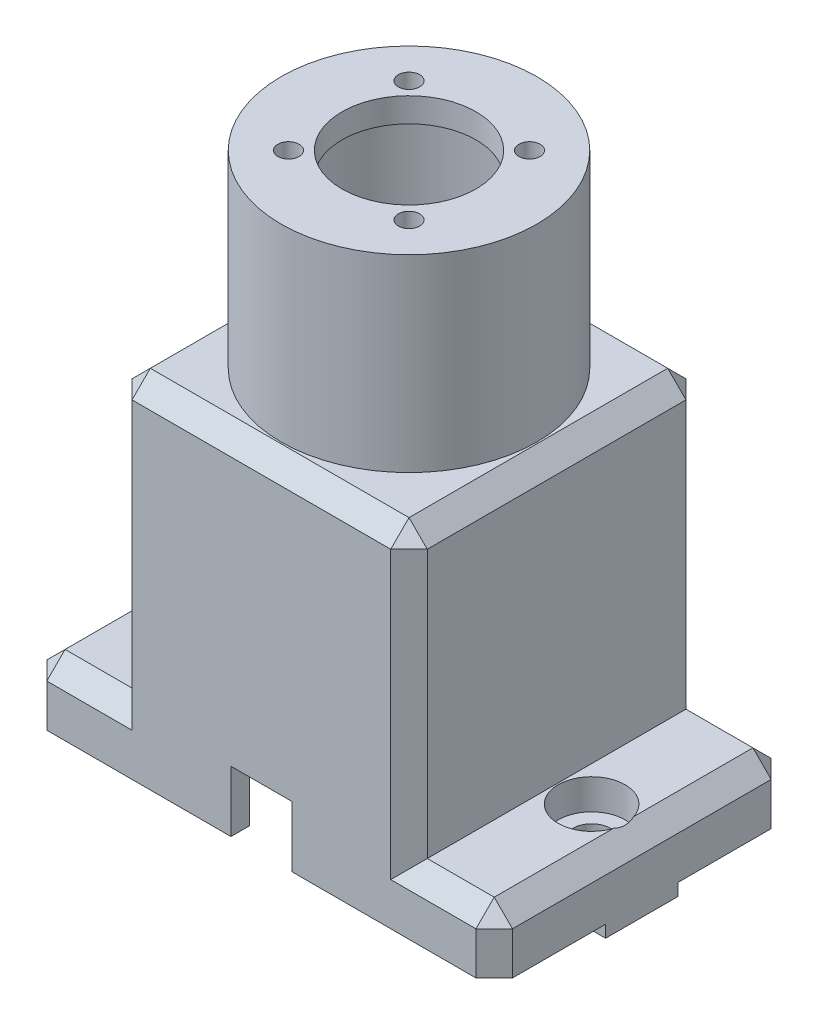
from build123d import *

# Parameters (mm, degrees)
SKETCH1_R               = 21
SKETCH1_R_2             = 1.75
BOSS_EXTRUDE1_DEPTH     = 31
SKETCH3_W               = 48.5
SKETCH3_H               = 48.5
SKETCH3_R               = 18.5
BOSS_EXTRUDE2_DEPTH     = 57
CUT_EXTRUDE2_DEPTH      = 67.521613029
CUT_EXTRUDE2_DEPTH_BACK = 67.521613029
SKETCH4_R               = 11
SKETCH5_W               = 10
SKETCH5_H               = 20
CUT_EXTRUDE3_DEPTH      = 67.521613029
BOSS_EXTRUDE3_START     = -57
SKETCH6_W               = 14
SKETCH6_H               = 48.5
BOSS_EXTRUDE3_DEPTH     = 10
BOSS_EXTRUDE4_START     = -57
SKETCH7_W               = 76.5
SKETCH7_H               = 11.9
BOSS_EXTRUDE4_DEPTH     = 2
CUT_EXTRUDE1_DEPTH      = 27
CUT_EXTRUDE1_DEPTH_BACK = 75.378256231
SKETCH2_R               = 18.5
SKETCH8_R               = 3.1
CUT_EXTRUDE4_DEPTH      = 75.378256231
CUT_EXTRUDE5_START      = -47
SKETCH9_R               = 5.5
CUT_EXTRUDE5_DEPTH      = 5
CUT_EXTRUDE6_DEPTH      = 53
CUT_EXTRUDE6_DEPTH_BACK = 75.378256231
CUT_EXTRUDE6_START      = -57
SKETCH11_W              = 42.5
SKETCH11_H              = 42.4


with BuildPart() as part:
    # Sketch1 → Boss-Extrude1 (new body)
    with BuildSketch(Plane(origin=(0, 0, 0), x_dir=(1, 0, 0), z_dir=(0, 1, 0))):
        with Locations(Location((0, 0, 0), (0, 0, 270))):
            Circle(SKETCH1_R)
        with Locations(Location((-9.899494937, -9.899494937, 0), (0, 0, 270))):
            Circle(SKETCH1_R_2, mode=Mode.SUBTRACT)
        with Locations(Location((-9.899494937, 9.899494937, 0), (0, 0, 270))):
            Circle(SKETCH1_R_2, mode=Mode.SUBTRACT)
        with Locations(Location((9.899494937, 9.899494937, 0), (0, 0, 270))):
            Circle(SKETCH1_R_2, mode=Mode.SUBTRACT)
        with Locations(Location((9.899494937, -9.899494937, 0), (0, 0, 270))):
            Circle(SKETCH1_R_2, mode=Mode.SUBTRACT)
    extrude(amount=BOSS_EXTRUDE1_DEPTH)

    # Sketch3 → Boss-Extrude2 (add)
    with BuildSketch(Plane(origin=(0, 0, 0), x_dir=(1, 0, 0), z_dir=(0, 1, 0))):
        Rectangle(SKETCH3_W, SKETCH3_H)
        with Locations(Location((0, 0, 0), (0, 0, 270))):
            Circle(SKETCH3_R, mode=Mode.SUBTRACT)
    extrude(amount=-BOSS_EXTRUDE2_DEPTH)

    # Sketch4 → Cut-Extrude2 (cut, two sides: drawn at the far end of the back side and taken through both)
    with BuildSketch(Plane(origin=(0, 0, 0), x_dir=(1, 0, 0), z_dir=(0, 1, 0)).offset(-CUT_EXTRUDE2_DEPTH_BACK)):
        with Locations(Location((0, 0, 0), (0, 0, 270))):
            Circle(SKETCH4_R)
    extrude(amount=CUT_EXTRUDE2_DEPTH + CUT_EXTRUDE2_DEPTH_BACK, mode=Mode.SUBTRACT)

    # Sketch5 → Cut-Extrude3 (cut, through all)
    with BuildSketch(Plane.XY):
        with Locations((0, -57)):
            Rectangle(SKETCH5_W, SKETCH5_H)
    extrude(amount=CUT_EXTRUDE3_DEPTH, mode=Mode.SUBTRACT)

    # Sketch6 → Boss-Extrude3 (add)
    with BuildSketch(Plane(origin=(0, 0, 0), x_dir=(1, 0, 0), z_dir=(0, 1, 0)).offset(BOSS_EXTRUDE3_START)):
        with Locations((-31.25, 0)):
            Rectangle(SKETCH6_W, SKETCH6_H)
        with Locations((31.25, 0)):
            Rectangle(SKETCH6_W, SKETCH6_H)
    extrude(amount=BOSS_EXTRUDE3_DEPTH)

    # Sketch7 → Boss-Extrude4 (add)
    with BuildSketch(Plane(origin=(0, 0, 0), x_dir=(1, 0, 0), z_dir=(0, 1, 0)).offset(BOSS_EXTRUDE4_START)):
        Rectangle(SKETCH7_W, SKETCH7_H)
    extrude(amount=-BOSS_EXTRUDE4_DEPTH)

    # Sketch2 → Cut-Extrude1 (cut, two sides: drawn at the far end of the back side and taken through both)
    with BuildSketch(Plane(origin=(0, 0, 0), x_dir=(1, 0, 0), z_dir=(0, 1, 0)).offset(-CUT_EXTRUDE1_DEPTH_BACK)):
        with Locations(Location((0, 0, 0), (0, 0, 270))):
            Circle(SKETCH2_R)
    extrude(amount=CUT_EXTRUDE1_DEPTH + CUT_EXTRUDE1_DEPTH_BACK, mode=Mode.SUBTRACT)

    # Sketch8 → Cut-Extrude4 (cut, through all)
    with BuildSketch(Plane(origin=(0, 0, 0), x_dir=(1, 0, 0), z_dir=(0, 1, 0))):
        with Locations(Location((-30, 0, 0), (0, 0, 270))):
            Circle(SKETCH8_R)
        with Locations(Location((30, 0, 0), (0, 0, 270))):
            Circle(SKETCH8_R)
    extrude(amount=-CUT_EXTRUDE4_DEPTH, mode=Mode.SUBTRACT)

    # Sketch9 → Cut-Extrude5 (cut)
    with BuildSketch(Plane(origin=(0, 0, 0), x_dir=(1, 0, 0), z_dir=(0, 1, 0)).offset(CUT_EXTRUDE5_START)):
        with Locations(Location((-30, 0, 0), (0, 0, 270))):
            Circle(SKETCH9_R)
        with Locations(Location((30, 0, 0), (0, 0, 270))):
            Circle(SKETCH9_R)
    extrude(amount=-CUT_EXTRUDE5_DEPTH, mode=Mode.SUBTRACT)

    # Chamfer1
    # the kernel refuses this chamfer: 3 mm, written as the material it takes off along each edge
    with BuildSketch(Plane(origin=(-22.25, -2, 22.25), x_dir=(0, -0.7071067811865476, 0.7071067811865476), z_dir=(-0.5773502691896257, 0.5773502691896257, 0.5773502691896257)), Plane(origin=(-22.25, -2, -22.25), x_dir=(-0.7071067811865476, -0.7071067811865476, 0), z_dir=(-0.5773502691896257, 0.5773502691896257, -0.5773502691896257)), Plane(origin=(36.25, -49, 22.25), x_dir=(-1.6747652892626914e-15, 0.7071067811865467, -0.7071067811865483), z_dir=(0.5773502691896266, 0.5773502691896266, 0.577350269189624))) as chamfer1_piece_1:
        Polygon((-2.121320344, 1.224744871), (2.121320344, 1.224744871), (0, -2.449489743), align=None)
    extrude(amount=3.810511777, mode=Mode.SUBTRACT)
    with BuildSketch(Plane(origin=(22.25, -2, 22.25), x_dir=(0, -0.7071067811865476, 0.7071067811865476), z_dir=(0.5773502691896257, 0.5773502691896257, 0.5773502691896257)), Plane(origin=(22.25, -2, -22.25), x_dir=(0.7071067811865476, -0.7071067811865476, 0), z_dir=(0.5773502691896257, 0.5773502691896257, -0.5773502691896257)), Plane(origin=(-36.25, -49, -22.25), x_dir=(0.7071067811865476, 0.7071067811865476, 0), z_dir=(-0.5773502691896264, 0.5773502691896264, -0.5773502691896244)), Plane(origin=(-36.25, -49, 22.25), x_dir=(0.7071067811865479, 0, 0.707106781186547), z_dir=(-0.5773502691896255, 0.5773502691896255, 0.5773502691896262)), Plane(origin=(36.25, -49, -22.25), x_dir=(0.7071067811865476, -0.7071067811865476, 0), z_dir=(0.5773502691896251, 0.5773502691896258, -0.5773502691896265))) as chamfer1_piece_2:
        Polygon((-2.121320344, -1.224744871), (2.121320344, -1.224744871), (0, 2.449489743), align=None)
    extrude(amount=3.810511777, mode=Mode.SUBTRACT)
    with BuildSketch(Plane(origin=(-24.25, 0, 31.965048964), x_dir=(0.9996219169112968, 0.02749587661058636, 0), z_dir=(0, 0, -1)), Plane(origin=(31.965048964, 0, 24.25), x_dir=(0, 0.02749587661058636, -0.9996219169112968), z_dir=(-1, 0, 0)), Plane(origin=(24.25, 0, -31.965048964), x_dir=(-0.9996219169112968, 0.02749587661058636, 0), z_dir=(0, 0, 1)), Plane(origin=(-31.965048964, 0, -24.25), x_dir=(0, 0.02749587661058636, 0.9996219169112968), z_dir=(1, 0, 0))) as chamfer1_piece_3:
        with BuildLine():
            Line((3.086019586, 0), (-0.169641465, 3.081353381))
            Line((-0.169641465, 3.081353381), (-0.22961878, 3.079703628))
            ThreePointArc((-0.22961878, 3.079703628), (-0.102387681, 1.540193489), (-0.059977315, -0.001649753))
            Line((-0.059977315, -0.001649753), (0.001649753, -0.059977315))
            ThreePointArc((0.001649753, -0.059977315), (1.543492994, -0.017566949), (3.087669338, -0.059977315))
            Line((3.087669338, -0.059977315), (3.086019586, 0))
        make_face()
    extrude(amount=63.930097928, mode=Mode.SUBTRACT)
    with BuildSketch(Plane(origin=(-24.25, 7.715048964, -24.25), x_dir=(-0.027495876610586768, 0, 0.9996219169112968), z_dir=(0, -1, 0)), Plane(origin=(-24.25, 7.715048964, 24.25), x_dir=(0.9996219169112965, 0, 0.02749587661058676), z_dir=(0, -1, 0))) as chamfer1_piece_4:
        with BuildLine():
            Line((3.086019586, 0), (-0.169641465, -3.081353381))
            Line((-0.169641465, -3.081353381), (-0.22961878, -3.079703628))
            ThreePointArc((-0.22961878, -3.079703628), (-0.102387681, -1.540193489), (-0.059977315, 0.001649753))
            Line((-0.059977315, 0.001649753), (0.001649753, 0.059977315))
            ThreePointArc((0.001649753, 0.059977315), (1.543492994, 0.017566949), (3.087669338, 0.059977315))
            Line((3.087669338, 0.059977315), (3.086019586, 0))
        make_face()
    extrude(amount=54.715048964, mode=Mode.SUBTRACT)
    with BuildSketch(Plane(origin=(-38.25, -64.715048964, -24.25), x_dir=(0.9996219169112965, 0, -0.027495876610587913), z_dir=(0, 1, 0)), Plane(origin=(38.25, -64.715048964, 24.25), x_dir=(-0.9996219169112965, 0, 0.027495876610587913), z_dir=(0, 1, 0))) as chamfer1_piece_5:
        with BuildLine():
            Line((3.086019586, 0), (-0.169641465, -3.081353381))
            Line((-0.169641465, -3.081353381), (-0.22961878, -3.079703628))
            ThreePointArc((-0.22961878, -3.079703628), (-0.102387681, -1.540193489), (-0.059977315, 0.001649753))
            Line((-0.059977315, 0.001649753), (0.001649753, 0.059977315))
            ThreePointArc((0.001649753, 0.059977315), (1.543492994, 0.017566949), (3.087669338, 0.059977315))
            Line((3.087669338, 0.059977315), (3.086019586, 0))
        make_face()
    extrude(amount=25.430097928, mode=Mode.SUBTRACT)
    with BuildSketch(Plane(origin=(-38.25, -64.715048964, 24.25), x_dir=(0.9996219169112968, 0, 0.027495876610585616), z_dir=(0, 1, 0)), Plane(origin=(38.25, -64.715048964, -24.25), x_dir=(-0.9996219169112968, 0, -0.027495876610585616), z_dir=(0, 1, 0))) as chamfer1_piece_6:
        with BuildLine():
            Line((3.086019586, 0), (-0.169641465, 3.081353381))
            Line((-0.169641465, 3.081353381), (-0.22961878, 3.079703628))
            ThreePointArc((-0.22961878, 3.079703628), (-0.102387681, 1.540193489), (-0.059977315, -0.001649753))
            Line((-0.059977315, -0.001649753), (0.001649753, -0.059977315))
            ThreePointArc((0.001649753, -0.059977315), (1.543492994, -0.017566949), (3.087669338, -0.059977315))
            Line((3.087669338, -0.059977315), (3.086019586, 0))
        make_face()
    extrude(amount=25.430097928, mode=Mode.SUBTRACT)
    with BuildSketch(Plane(origin=(-45.965048964, -47, -24.25), x_dir=(0, -0.9996219169112965, -0.02749587661058676), z_dir=(1, 0, 0)), Plane(origin=(-24.25, -47, 24.25), x_dir=(0, -0.9996219169112965, 0.02749587661058676), z_dir=(-1, 0, 0))) as chamfer1_piece_7:
        with BuildLine():
            Line((3.086019586, 0), (-0.169641465, -3.081353381))
            Line((-0.169641465, -3.081353381), (-0.22961878, -3.079703628))
            ThreePointArc((-0.22961878, -3.079703628), (-0.102387681, -1.540193489), (-0.059977315, 0.001649753))
            Line((-0.059977315, 0.001649753), (0.001649753, 0.059977315))
            ThreePointArc((0.001649753, 0.059977315), (1.543492994, 0.017566949), (3.087669338, 0.059977315))
            Line((3.087669338, 0.059977315), (3.086019586, 0))
        make_face()
    extrude(amount=21.715048964, mode=Mode.SUBTRACT)
    with BuildSketch(Plane(origin=(-38.25, -47, 31.965048964), x_dir=(-0.027495876610586768, -0.9996219169112968, 0), z_dir=(0, 0, -1)), Plane(origin=(38.25, -47, 31.965048964), x_dir=(-0.9996219169112965, 0.02749587661058676, 0), z_dir=(0, 0, -1))) as chamfer1_piece_8:
        with BuildLine():
            Line((3.086019586, 0), (-0.169641465, -3.081353381))
            Line((-0.169641465, -3.081353381), (-0.22961878, -3.079703628))
            ThreePointArc((-0.22961878, -3.079703628), (-0.102387681, -1.540193489), (-0.059977315, 0.001649753))
            Line((-0.059977315, 0.001649753), (0.001649753, 0.059977315))
            ThreePointArc((0.001649753, 0.059977315), (1.543492994, 0.017566949), (3.087669338, 0.059977315))
            Line((3.087669338, 0.059977315), (3.086019586, 0))
        make_face()
    extrude(amount=63.930097928, mode=Mode.SUBTRACT)
    with BuildSketch(Plane(origin=(24.25, 7.715048964, 24.25), x_dir=(-0.9996219169112965, 0, 0.02749587661058676), z_dir=(0, -1, 0)), Plane(origin=(24.25, 7.715048964, -24.25), x_dir=(0.027495876610586768, 0, 0.9996219169112968), z_dir=(0, -1, 0))) as chamfer1_piece_9:
        with BuildLine():
            Line((3.086019586, 0), (-0.169641465, 3.081353381))
            Line((-0.169641465, 3.081353381), (-0.22961878, 3.079703628))
            ThreePointArc((-0.22961878, 3.079703628), (-0.102387681, 1.540193489), (-0.059977315, -0.001649753))
            Line((-0.059977315, -0.001649753), (0.001649753, -0.059977315))
            ThreePointArc((0.001649753, -0.059977315), (1.543492994, -0.017566949), (3.087669338, -0.059977315))
            Line((3.087669338, -0.059977315), (3.086019586, 0))
        make_face()
    extrude(amount=54.715048964, mode=Mode.SUBTRACT)
    with BuildSketch(Plane(origin=(45.965048964, -47, -24.25), x_dir=(0, -0.9996219169112965, -0.02749587661058676), z_dir=(-1, 0, 0)), Plane(origin=(24.25, -47, 24.25), x_dir=(0, -0.9996219169112965, 0.02749587661058676), z_dir=(1, 0, 0))) as chamfer1_piece_10:
        with BuildLine():
            Line((3.086019586, 0), (-0.169641465, 3.081353381))
            Line((-0.169641465, 3.081353381), (-0.22961878, 3.079703628))
            ThreePointArc((-0.22961878, 3.079703628), (-0.102387681, 1.540193489), (-0.059977315, -0.001649753))
            Line((-0.059977315, -0.001649753), (0.001649753, -0.059977315))
            ThreePointArc((0.001649753, -0.059977315), (1.543492994, -0.017566949), (3.087669338, -0.059977315))
            Line((3.087669338, -0.059977315), (3.086019586, 0))
        make_face()
    extrude(amount=21.715048964, mode=Mode.SUBTRACT)
    with BuildSketch(Plane(origin=(-24.25, 7.715048964, -24.25), x_dir=(-0.027495876610586768, 0, 0.9996219169112968), z_dir=(0, -1, 0))) as chamfer1_piece_11a_section:
        with BuildLine():
            Line((3.086019586, 0), (-0.169641465, -3.081353381))
            Line((-0.169641465, -3.081353381), (-0.22961878, -3.079703628))
            ThreePointArc((-0.22961878, -3.079703628), (-0.102387681, -1.540193489), (-0.059977315, 0.001649753))
            Line((-0.059977315, 0.001649753), (0.001649753, 0.059977315))
            ThreePointArc((0.001649753, 0.059977315), (1.543492994, 0.017566949), (3.087669338, 0.059977315))
            Line((3.087669338, 0.059977315), (3.086019586, 0))
        make_face()
    chamfer1_piece_11a = extrude(amount=62.430097928, mode=Mode.PRIVATE)
    chamfer1_piece_11a = split(chamfer1_piece_11a, bisect_by=Plane(origin=(-23.26061912, -47, -23.26061912), z_dir=(0, -1, 0)), keep=Keep.TOP, mode=Mode.PRIVATE)
    with BuildSketch(Plane(origin=(-45.965048964, -47, -24.25), x_dir=(0, -0.9996219169112965, -0.02749587661058676), z_dir=(1, 0, 0))) as chamfer1_piece_11b_section:
        with BuildLine():
            Line((3.086019586, 0), (-0.169641465, -3.081353381))
            Line((-0.169641465, -3.081353381), (-0.22961878, -3.079703628))
            ThreePointArc((-0.22961878, -3.079703628), (-0.102387681, -1.540193489), (-0.059977315, 0.001649753))
            Line((-0.059977315, 0.001649753), (0.001649753, 0.059977315))
            ThreePointArc((0.001649753, 0.059977315), (1.543492994, 0.017566949), (3.087669338, 0.059977315))
            Line((3.087669338, 0.059977315), (3.086019586, 0))
        make_face()
    chamfer1_piece_11b = extrude(amount=29.430097928, mode=Mode.PRIVATE)
    chamfer1_piece_11b = split(chamfer1_piece_11b, bisect_by=Plane(origin=(-24.25, -47.98938088, -23.26061912), z_dir=(1, 0, 0)), keep=Keep.TOP, mode=Mode.PRIVATE)
    chamfer1_piece_11 = chamfer1_piece_11a & chamfer1_piece_11b
    add(chamfer1_piece_11, mode=Mode.SUBTRACT)
    with BuildSketch(Plane(origin=(-16.534951036, -47, 24.25), x_dir=(0, -0.9996219169112965, 0.02749587661058676), z_dir=(-1, 0, 0))) as chamfer1_piece_12a_section:
        with BuildLine():
            Line((3.086019586, 0), (-0.169641465, -3.081353381))
            Line((-0.169641465, -3.081353381), (-0.22961878, -3.079703628))
            ThreePointArc((-0.22961878, -3.079703628), (-0.102387681, -1.540193489), (-0.059977315, 0.001649753))
            Line((-0.059977315, 0.001649753), (0.001649753, 0.059977315))
            ThreePointArc((0.001649753, 0.059977315), (1.543492994, 0.017566949), (3.087669338, 0.059977315))
            Line((3.087669338, 0.059977315), (3.086019586, 0))
        make_face()
    chamfer1_piece_12a = extrude(amount=29.430097928, mode=Mode.PRIVATE)
    chamfer1_piece_12a = split(chamfer1_piece_12a, bisect_by=Plane(origin=(-24.25, -47.98938088, 23.26061912), z_dir=(1, 0, 0)), keep=Keep.TOP, mode=Mode.PRIVATE)
    with BuildSketch(Plane(origin=(-24.25, 7.715048964, 24.25), x_dir=(0.9996219169112965, 0, 0.02749587661058676), z_dir=(0, -1, 0))) as chamfer1_piece_12b_section:
        with BuildLine():
            Line((3.086019586, 0), (-0.169641465, -3.081353381))
            Line((-0.169641465, -3.081353381), (-0.22961878, -3.079703628))
            ThreePointArc((-0.22961878, -3.079703628), (-0.102387681, -1.540193489), (-0.059977315, 0.001649753))
            Line((-0.059977315, 0.001649753), (0.001649753, 0.059977315))
            ThreePointArc((0.001649753, 0.059977315), (1.543492994, 0.017566949), (3.087669338, 0.059977315))
            Line((3.087669338, 0.059977315), (3.086019586, 0))
        make_face()
    chamfer1_piece_12b = extrude(amount=62.430097928, mode=Mode.PRIVATE)
    chamfer1_piece_12b = split(chamfer1_piece_12b, bisect_by=Plane(origin=(-23.26061912, -47, 23.26061912), z_dir=(0, -1, 0)), keep=Keep.TOP, mode=Mode.PRIVATE)
    chamfer1_piece_12 = chamfer1_piece_12a & chamfer1_piece_12b
    add(chamfer1_piece_12, mode=Mode.SUBTRACT)
    with BuildSketch(Plane(origin=(24.25, 7.715048964, 24.25), x_dir=(-0.9996219169112965, 0, 0.02749587661058676), z_dir=(0, -1, 0))) as chamfer1_piece_13a_section:
        with BuildLine():
            Line((3.086019586, 0), (-0.169641465, 3.081353381))
            Line((-0.169641465, 3.081353381), (-0.22961878, 3.079703628))
            ThreePointArc((-0.22961878, 3.079703628), (-0.102387681, 1.540193489), (-0.059977315, -0.001649753))
            Line((-0.059977315, -0.001649753), (0.001649753, -0.059977315))
            ThreePointArc((0.001649753, -0.059977315), (1.543492994, -0.017566949), (3.087669338, -0.059977315))
            Line((3.087669338, -0.059977315), (3.086019586, 0))
        make_face()
    chamfer1_piece_13a = extrude(amount=62.430097928, mode=Mode.PRIVATE)
    chamfer1_piece_13a = split(chamfer1_piece_13a, bisect_by=Plane(origin=(23.26061912, -47, 23.26061912), z_dir=(0, -1, 0)), keep=Keep.TOP, mode=Mode.PRIVATE)
    with BuildSketch(Plane(origin=(16.534951036, -47, 24.25), x_dir=(0, -0.9996219169112965, 0.02749587661058676), z_dir=(1, 0, 0))) as chamfer1_piece_13b_section:
        with BuildLine():
            Line((3.086019586, 0), (-0.169641465, 3.081353381))
            Line((-0.169641465, 3.081353381), (-0.22961878, 3.079703628))
            ThreePointArc((-0.22961878, 3.079703628), (-0.102387681, 1.540193489), (-0.059977315, -0.001649753))
            Line((-0.059977315, -0.001649753), (0.001649753, -0.059977315))
            ThreePointArc((0.001649753, -0.059977315), (1.543492994, -0.017566949), (3.087669338, -0.059977315))
            Line((3.087669338, -0.059977315), (3.086019586, 0))
        make_face()
    chamfer1_piece_13b = extrude(amount=29.430097928, mode=Mode.PRIVATE)
    chamfer1_piece_13b = split(chamfer1_piece_13b, bisect_by=Plane(origin=(24.25, -47.98938088, 23.26061912), z_dir=(-1, 0, 0)), keep=Keep.TOP, mode=Mode.PRIVATE)
    chamfer1_piece_13 = chamfer1_piece_13a & chamfer1_piece_13b
    add(chamfer1_piece_13, mode=Mode.SUBTRACT)
    with BuildSketch(Plane(origin=(24.25, 7.715048964, -24.25), x_dir=(0.027495876610586768, 0, 0.9996219169112968), z_dir=(0, -1, 0))) as chamfer1_piece_14a_section:
        with BuildLine():
            Line((3.086019586, 0), (-0.169641465, 3.081353381))
            Line((-0.169641465, 3.081353381), (-0.22961878, 3.079703628))
            ThreePointArc((-0.22961878, 3.079703628), (-0.102387681, 1.540193489), (-0.059977315, -0.001649753))
            Line((-0.059977315, -0.001649753), (0.001649753, -0.059977315))
            ThreePointArc((0.001649753, -0.059977315), (1.543492994, -0.017566949), (3.087669338, -0.059977315))
            Line((3.087669338, -0.059977315), (3.086019586, 0))
        make_face()
    chamfer1_piece_14a = extrude(amount=62.430097928, mode=Mode.PRIVATE)
    chamfer1_piece_14a = split(chamfer1_piece_14a, bisect_by=Plane(origin=(23.26061912, -47, -23.26061912), z_dir=(0, -1, 0)), keep=Keep.TOP, mode=Mode.PRIVATE)
    with BuildSketch(Plane(origin=(45.965048964, -47, -24.25), x_dir=(0, -0.9996219169112965, -0.02749587661058676), z_dir=(-1, 0, 0))) as chamfer1_piece_14b_section:
        with BuildLine():
            Line((3.086019586, 0), (-0.169641465, 3.081353381))
            Line((-0.169641465, 3.081353381), (-0.22961878, 3.079703628))
            ThreePointArc((-0.22961878, 3.079703628), (-0.102387681, 1.540193489), (-0.059977315, -0.001649753))
            Line((-0.059977315, -0.001649753), (0.001649753, -0.059977315))
            ThreePointArc((0.001649753, -0.059977315), (1.543492994, -0.017566949), (3.087669338, -0.059977315))
            Line((3.087669338, -0.059977315), (3.086019586, 0))
        make_face()
    chamfer1_piece_14b = extrude(amount=29.430097928, mode=Mode.PRIVATE)
    chamfer1_piece_14b = split(chamfer1_piece_14b, bisect_by=Plane(origin=(24.25, -47.98938088, -23.26061912), z_dir=(-1, 0, 0)), keep=Keep.TOP, mode=Mode.PRIVATE)
    chamfer1_piece_14 = chamfer1_piece_14a & chamfer1_piece_14b
    add(chamfer1_piece_14, mode=Mode.SUBTRACT)

    # Sketch11 → Cut-Extrude6 (cut, two sides: drawn at the far end of the back side and taken through both)
    with BuildSketch(Plane(origin=(0, 0, 0), x_dir=(1, 0, 0), z_dir=(0, 1, 0)).offset(CUT_EXTRUDE6_START - CUT_EXTRUDE6_DEPTH_BACK)):
        Rectangle(SKETCH11_W, SKETCH11_H)
    extrude(amount=CUT_EXTRUDE6_DEPTH + CUT_EXTRUDE6_DEPTH_BACK, mode=Mode.SUBTRACT)


solid = part.part
